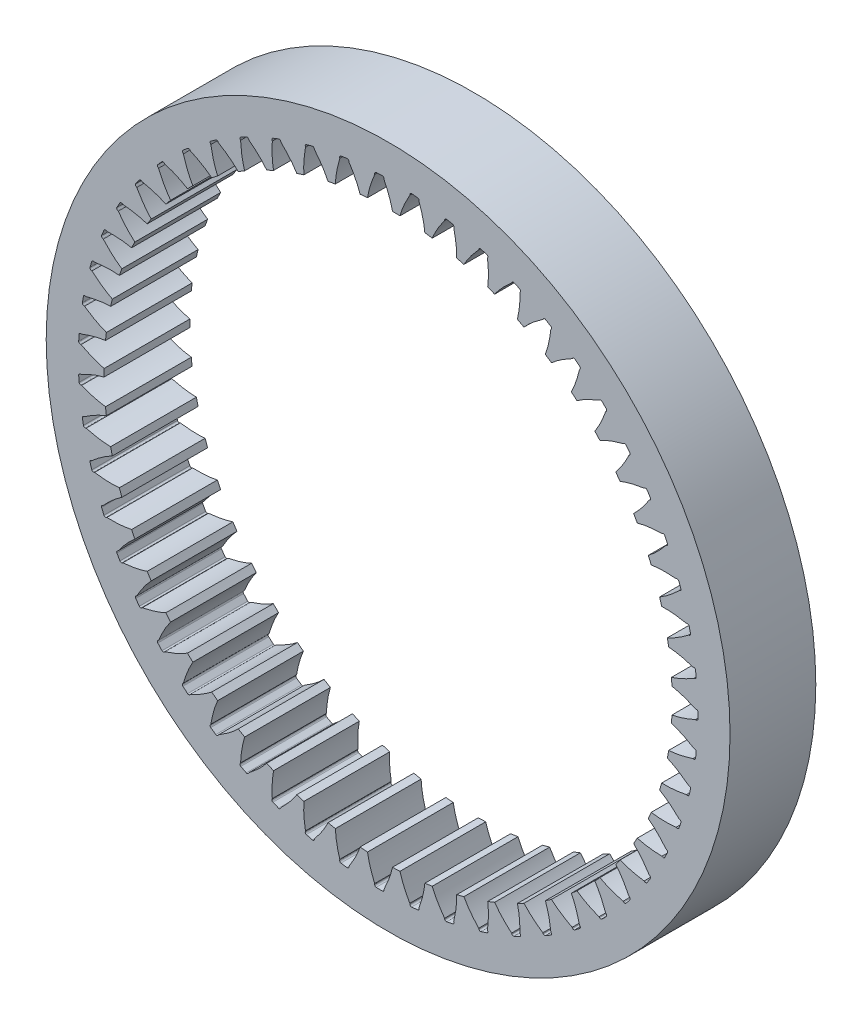
from build123d import *

# Parameters (mm, degrees)
BLANK_SKETCH_R    = 39.875
BLANK_SKETCH_R_2  = 33.125
BLANK_DEPTH       = 10
TOOTH_SPACE_DEPTH = 58.271557077
TEETH_COUNT       = 55


with BuildPart() as part:
    # Blank Sketch → Blank (new body)
    with BuildSketch(Plane.XY):
        Circle(BLANK_SKETCH_R)
        Circle(BLANK_SKETCH_R_2, mode=Mode.SUBTRACT)
    extrude(amount=BLANK_DEPTH)

    # Tooth Space Sketch → Tooth Space (cut, symmetric)
    with BuildSketch(Plane.XY):
        with BuildLine():
            Line((32.463533146, 1.539160707), (31.839234432, 1.509561463))
            Line((31.839234432, 1.509561463), (31.839234432, -1.509561463))
            Line((31.839234432, -1.509561463), (32.463533146, -1.539160707))
            add(Edge.make_bspline(
                [(32.463533146, -1.539160707), (32.479664306, -1.538141769), (32.512585957, -1.535804805), (32.58910155, -1.529715308), (32.671984568, -1.520906361), (32.77779182, -1.508356597), (32.883422486, -1.493249511), (32.993509589, -1.475965297), (33.100567742, -1.457145138), (33.208969662, -1.436592978), (33.316055537, -1.414644577), (33.423528796, -1.391160228), (33.553667152, -1.361026927), (33.710689689, -1.321973669), (33.89224505, -1.273453345), (34.101003466, -1.212647168), (34.308743945, -1.148060432), (34.519669272, -1.077484432), (34.722164556, -1.006484363), (34.935040184, -0.926556066), (35.127476356, -0.852107834), (35.350181319, -0.759840717), (35.519328672, -0.688645986), (35.710214992, -0.602964062), (35.795612262, -0.564044547), (35.839626296, -0.54369201)],
                knots=[0.027603686, 0.027603686, 0.027603686, 0.027603686, 0.027603686, 0.04588116, 0.064917983, 0.092335275, 0.119752856, 0.147169869, 0.174587361, 0.202004624, 0.229421871, 0.256839297, 0.284256477, 0.311673811, 0.363254706, 0.418089376, 0.472923867, 0.527758361, 0.582592988, 0.637427473, 0.692262011, 0.747096564, 0.801931187, 0.856765725, 0.911600339, 0.911600339, 0.911600339, 0.911600339, 0.911600339], degree=4))
            Line((35.839626296, -0.54369201), (35.932876433, -0.545106627))
            ThreePointArc((35.932876433, -0.545106627), (36.066627342, -0.491865489), (36.123211222, -0.359494084))
            ThreePointArc((36.123211222, -0.359494084), (36.125, 0), (36.123211222, 0.359494084))
            ThreePointArc((36.123211222, 0.359494084), (36.066627342, 0.491865489), (35.932876433, 0.545106627))
            Line((35.932876433, 0.545106627), (35.839626296, 0.54369201))
            add(Edge.make_bspline(
                [(32.463533146, 1.539160707), (32.479664306, 1.538141769), (32.512585957, 1.535804805), (32.58910155, 1.529715308), (32.671984568, 1.520906361), (32.77779182, 1.508356597), (32.883422486, 1.493249511), (32.993509589, 1.475965297), (33.100567742, 1.457145138), (33.208969662, 1.436592978), (33.316055537, 1.414644577), (33.423528796, 1.391160228), (33.553667152, 1.361026927), (33.710689689, 1.321973669), (33.89224505, 1.273453345), (34.101003466, 1.212647168), (34.308743945, 1.148060432), (34.519669272, 1.077484432), (34.722164556, 1.006484363), (34.935040184, 0.926556066), (35.127476356, 0.852107834), (35.350181319, 0.759840717), (35.519328672, 0.688645986), (35.710214992, 0.602964062), (35.795612262, 0.564044547), (35.839626296, 0.54369201)],
                knots=[0.027603686, 0.027603686, 0.027603686, 0.027603686, 0.027603686, 0.04588116, 0.064917983, 0.092335275, 0.119752856, 0.147169869, 0.174587361, 0.202004624, 0.229421871, 0.256839297, 0.284256477, 0.311673811, 0.363254706, 0.418089376, 0.472923867, 0.527758361, 0.582592988, 0.637427473, 0.692262011, 0.747096564, 0.801931187, 0.856765725, 0.911600339, 0.911600339, 0.911600339, 0.911600339, 0.911600339], degree=4))
        make_face()
    tooth_space = extrude(amount=TOOTH_SPACE_DEPTH, both=True, mode=Mode.SUBTRACT)

    # Teeth: Tooth Space ×55 about axis
    teeth_axis = Axis((0, 0, -0.50007105), (0, 0, 1))
    for i in range(1, TEETH_COUNT):
        add(tooth_space.rotate(teeth_axis, i * 360 / TEETH_COUNT), mode=Mode.SUBTRACT)


solid = part.part
